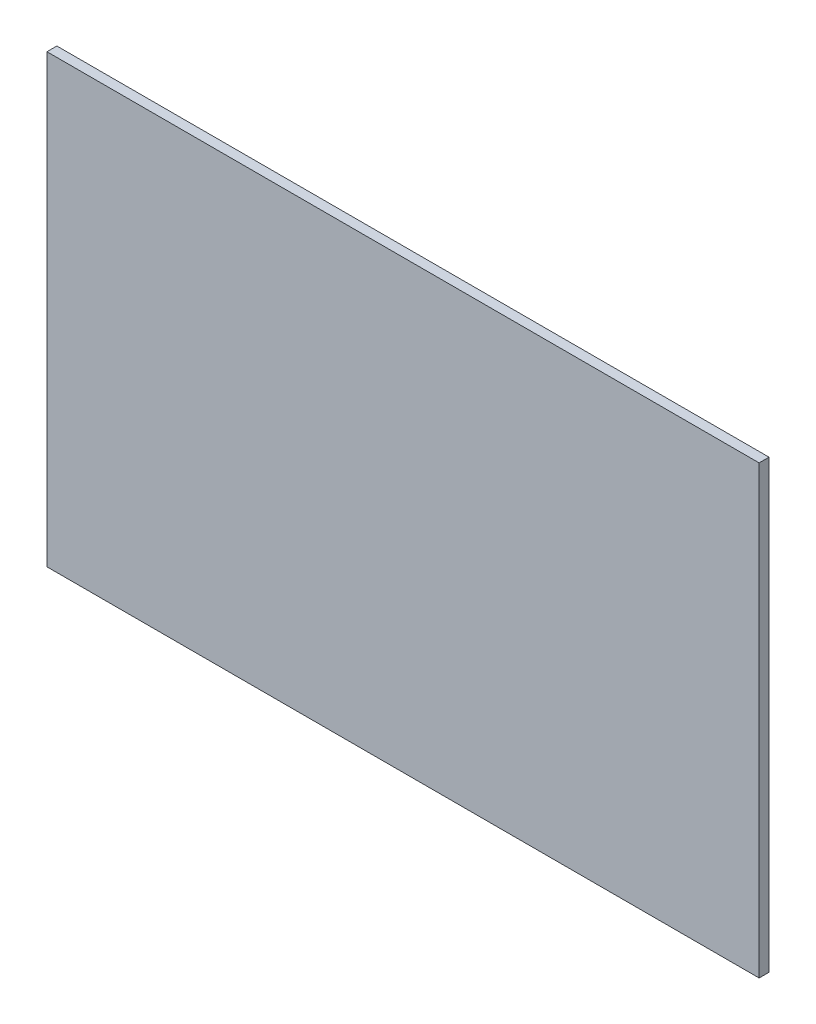
from build123d import *

# Parameters (mm, degrees)
SKETCH1_W           = 456.177532672
SKETCH1_H           = 285.75
BOSS_EXTRUDE1_DEPTH = 6.35


with BuildPart() as part:
    # Sketch1 → Boss-Extrude1 (new body)
    with BuildSketch(Plane.XY):
        with Locations((0, -142.875)):
            Rectangle(SKETCH1_W, SKETCH1_H)
    extrude(amount=BOSS_EXTRUDE1_DEPTH)


solid = part.part
